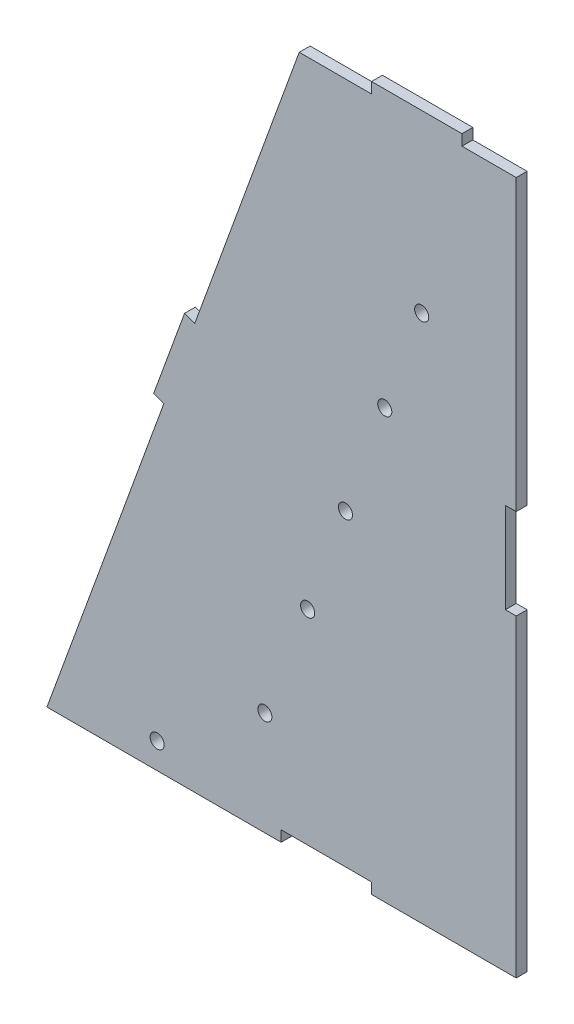
from build123d import *

# Parameters (mm, degrees)
EXTRUDE_1_DEPTH     = 3
SKETCH_2_R          = 1.95
CUT_EXTRUDE_1_DEPTH = 216.064527371


with BuildPart() as part:
    # Эскиз1 → Бобышка-Вытянуть1 (new body)
    with BuildSketch(Plane.XY):
        Polygon((-38.466499373, 0), (26.305609866, 0), (26.305609866, 3), (51.305609866, 3), (51.305609866, 0), (91.305609866, 0), (91.305609866, 86.69729464), (88.305609866, 86.69729464), (88.305609866, 111.69729464), (91.305609866, 111.69729464), (91.305609866, 191.69729464), (76.305609866, 191.69729464), (76.305609866, 194.69729464), (51.305609866, 194.69729464), (51.305609866, 191.69729464), (31.305609866, 191.69729464), (2.404907755, 112.293268184), (-0.414170108, 113.319328614), (-8.964673691, 89.827013094), (-6.145595828, 88.800952664), align=None)
    extrude(amount=EXTRUDE_1_DEPTH)

    # Эскиз2 → Вырез-Вытянуть1 (cut, through all)
    with BuildSketch(Plane.XY.offset(3)):
        with Locations((65.172313907, 146.156970696)):
            Circle(SKETCH_2_R)
        with Locations((54.952141167, 118.36965731)):
            Circle(SKETCH_2_R)
        with Locations((44.083143671, 88.214951678)):
            Circle(SKETCH_2_R)
        with Locations((33.623950426, 59.478554412)):
            Circle(SKETCH_2_R)
        with Locations((21.800189352, 28.704157669)):
            Circle(SKETCH_2_R)
        with Locations((-7.988233363, 7.134672363)):
            Circle(SKETCH_2_R)
    extrude(amount=-CUT_EXTRUDE_1_DEPTH, mode=Mode.SUBTRACT)


solid = part.part
